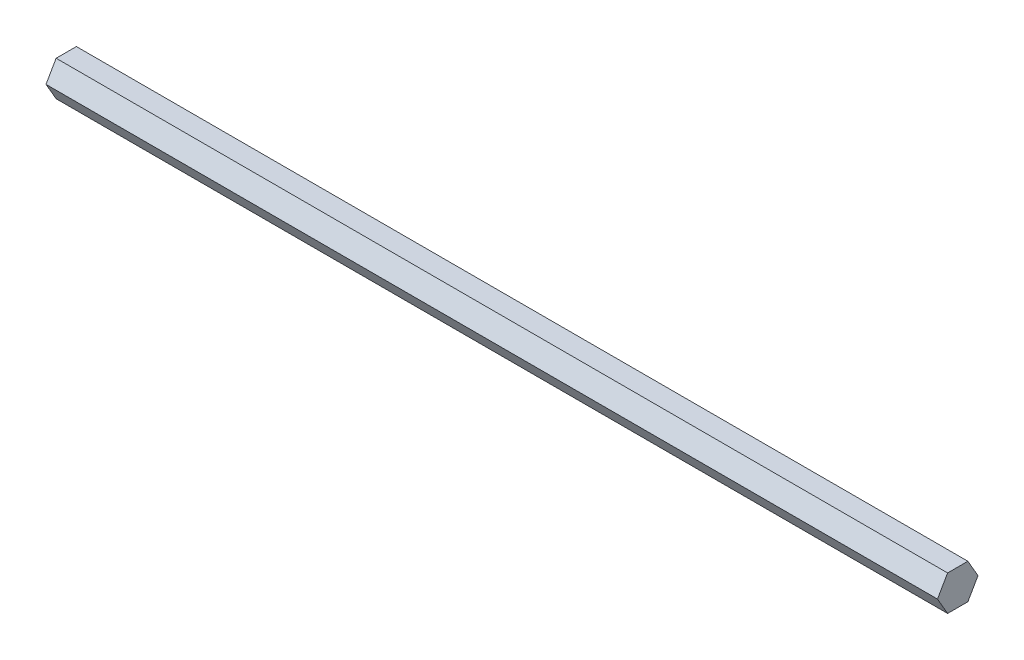
from build123d import *

# Parameters (mm, degrees)
BOSS_EXTRUDE1_DEPTH = 127


with BuildPart() as part:
    # Sketch1 → Boss-Extrude1 (new body)
    with BuildSketch(Plane(origin=(0, 0, 0), x_dir=(0, 0, -1), z_dir=(1, 0, 0))):
        Polygon((1.443375673, 2.5), (-1.443375673, 2.5), (-2.886751346, 0), (-1.443375673, -2.5), (1.443375673, -2.5), (2.886751346, 0), align=None)
    extrude(amount=BOSS_EXTRUDE1_DEPTH)


solid = part.part
